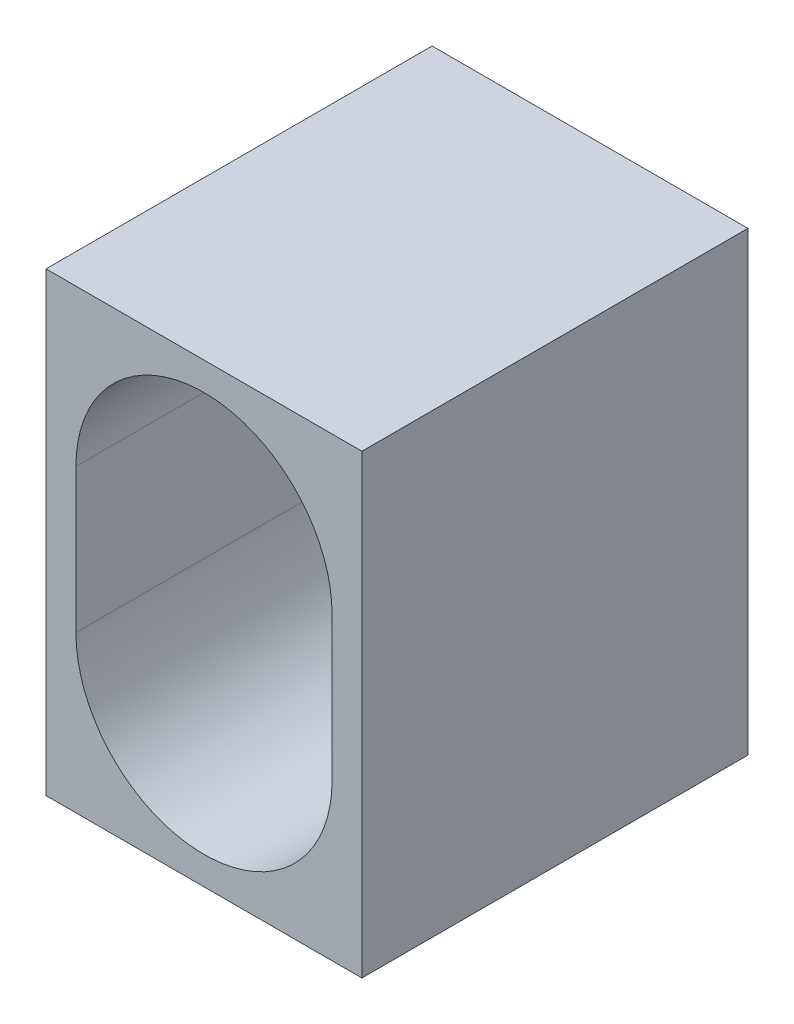
from build123d import *

# Parameters (mm, degrees)
SKETCH4_W           = 45
SKETCH4_H           = 65
BOSS_EXTRUDE2_DEPTH = 55
CUT_EXTRUDE1_DEPTH  = 52.5


with BuildPart() as part:
    # Sketch4 → Boss-Extrude2 (new body)
    with BuildSketch(Plane.XY):
        with Locations((-7.784904398, -11.939291809)):
            Rectangle(SKETCH4_W, SKETCH4_H)
    extrude(amount=BOSS_EXTRUDE2_DEPTH)

    # Sketch5 → Cut-Extrude1 (cut)
    with BuildSketch(Plane.XY.offset(55)):
        with BuildLine():
            Line((-26.034904398, -22.189291809), (-26.034904398, -1.689291809))
            ThreePointArc((-26.034904398, -1.689291809), (-7.784904398, 16.560708191), (10.465095602, -1.689291809))
            Line((10.465095602, -1.689291809), (10.465095602, -22.189291809))
            ThreePointArc((10.465095602, -22.189291809), (-7.784904398, -40.439291809), (-26.034904398, -22.189291809))
        make_face()
    extrude(amount=-CUT_EXTRUDE1_DEPTH, mode=Mode.SUBTRACT)


solid = part.part
